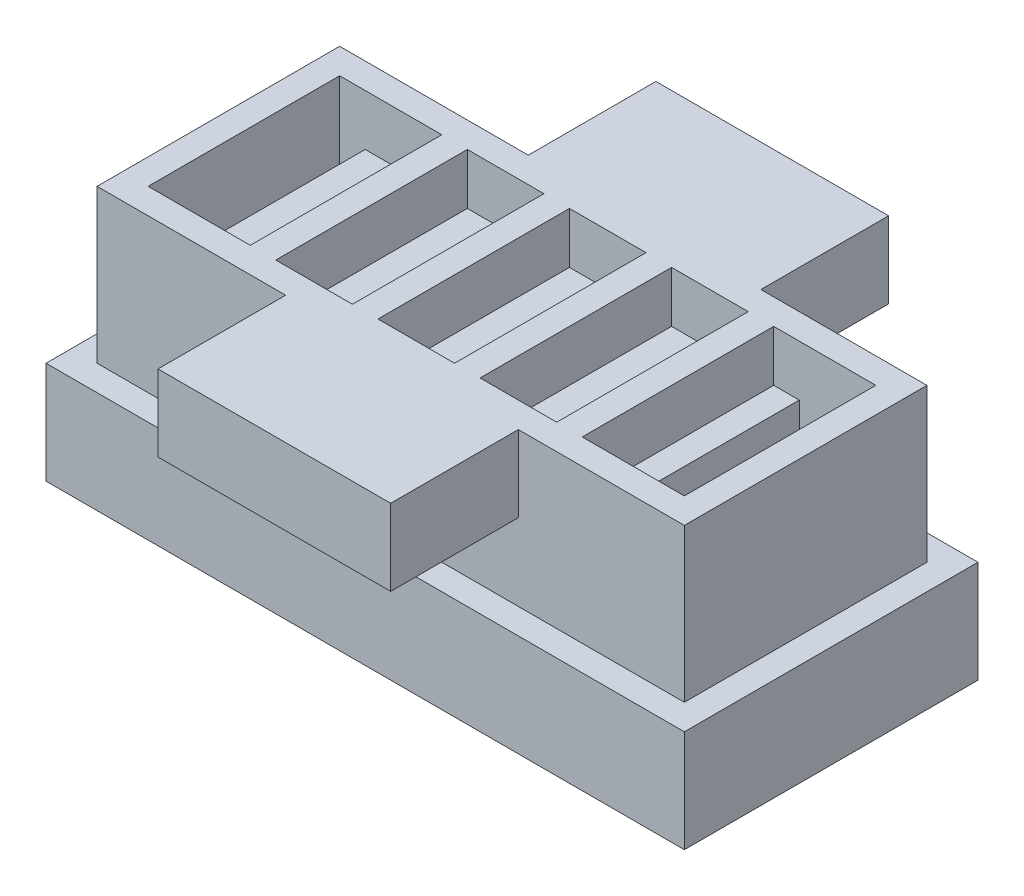
from build123d import *

# Parameters (mm, degrees)
SKETCH1_W           = 6
SKETCH1_H           = 15
BOSS_EXTRUDE1_DEPTH = 15
SKETCH2_W           = 2
SKETCH2_H           = 11
CUT_EXTRUDE1_DEPTH  = 13
SKETCH3_W           = 15
SKETCH3_H           = 4
BOSS_EXTRUDE2_DEPTH = 2
LPATTERN1_COUNT     = 5
LPATTERN1_PITCH     = 8
SKETCH6_W           = 15
SKETCH6_H           = 15
BOSS_EXTRUDE4_DEPTH = 2
SKETCH8_W           = 15
SKETCH8_H           = 11
BOSS_EXTRUDE5_DEPTH = 2
SKETCH9_W           = 34
SKETCH9_H           = 2
CUT_EXTRUDE2_DEPTH  = 2
BOSS_EXTRUDE6_START = -15
SKETCH10_W          = 46
SKETCH10_H          = 19
BOSS_EXTRUDE6_DEPTH = 20
SPLIT1_START        = -17
SPLIT1_OUTLINE_W    = 46
SPLIT1_OUTLINE_H    = 5
SPLIT1_DEPTH        = 19
SPLIT1_START_2      = -13
SPLIT1_2_OUTLINE_W  = 2
SPLIT1_2_OUTLINE_H  = 13
SPLIT1_2_DEPTH      = 11
SPLIT1_START_3      = -8.5
SPLIT1_3_OUTLINE_W  = 6
SPLIT1_3_OUTLINE_H  = 2
SPLIT1_3_DEPTH      = 2
SPLIT1_START_4      = -5
SPLIT1_4_OUTLINE_W  = 46
SPLIT1_4_OUTLINE_H  = 19
SPLIT1_4_DEPTH      = 5
SPLIT1_5_OUTLINE_W  = 2
SPLIT1_5_OUTLINE_H  = 11
SPLIT1_5_DEPTH      = 13
SPLIT1_6_OUTLINE_W  = 6
SPLIT1_6_OUTLINE_H  = 2
SPLIT1_6_DEPTH      = 2
SKETCH11_W          = 18.225114874
SKETCH11_H          = 5.976921675
BOSS_EXTRUDE7_DEPTH = 10
SKETCH12_W          = 50
SKETCH12_H          = 23
SKETCH12_W_2        = 46
SKETCH12_H_2        = 19
BOSS_EXTRUDE8_DEPTH = 8


# Read off the part's stored shape, not the designer's step: Split1
with BuildPart() as part:
    # Sketch1 → Boss-Extrude1 (new body)
    with BuildSketch(Plane(origin=(0, 0, 0), x_dir=(1, 0, 0), z_dir=(0, 1, 0))):
        with Locations((3, 7.5)):
            Rectangle(SKETCH1_W, SKETCH1_H)
    extrude(amount=BOSS_EXTRUDE1_DEPTH)

    # Sketch2 → Cut-Extrude1 (cut)
    with BuildSketch(Plane.XZ):
        with Locations((3, -7.5)):
            Rectangle(SKETCH2_W, SKETCH2_H)
    extrude(amount=-CUT_EXTRUDE1_DEPTH, mode=Mode.SUBTRACT)

    # Sketch3 → Boss-Extrude2 (add)
    with BuildSketch(Plane.ZY):
        with Locations((-7.5, 2)):
            Rectangle(SKETCH3_W, SKETCH3_H)
    extrude(amount=BOSS_EXTRUDE2_DEPTH)


with BuildPart() as lpattern1_1:
    # LPattern1: pattern copy
    add(part.part.moved(Location(Vector(-1, 0, 0) * (1 * LPATTERN1_PITCH))))


with BuildPart() as lpattern1_2:
    # LPattern1: pattern copy
    add(part.part.moved(Location(Vector(-1, 0, 0) * (2 * LPATTERN1_PITCH))))


with BuildPart() as lpattern1_3:
    # LPattern1: pattern copy
    add(part.part.moved(Location(Vector(-1, 0, 0) * (3 * LPATTERN1_PITCH))))


with BuildPart() as lpattern1_4:
    # LPattern1: pattern copy
    add(part.part.moved(Location(Vector(-1, 0, 0) * (4 * LPATTERN1_PITCH))))


with BuildPart() as lpattern1_1_1:
    add(lpattern1_1.part)

    # Combine1: union LPattern1_2, LPattern1_3, part, LPattern1_4
    add(lpattern1_2.part)
    add(lpattern1_3.part)
    add(part.part)
    add(lpattern1_4.part)

    # Sketch6 → Boss-Extrude4 (add)
    with BuildSketch(Plane(origin=(6, 0, 0), x_dir=(0, 0, -1), z_dir=(1, 0, 0))):
        with Locations((7.5, 7.5)):
            Rectangle(SKETCH6_W, SKETCH6_H)
    extrude(amount=BOSS_EXTRUDE4_DEPTH)

    # Sketch8 → Boss-Extrude5 (add)
    with BuildSketch(Plane.ZY.offset(32)):
        with Locations((-7.5, 9.5)):
            Rectangle(SKETCH8_W, SKETCH8_H)
    extrude(amount=BOSS_EXTRUDE5_DEPTH)

    # Sketch9 → Cut-Extrude2 (cut)
    with BuildSketch(Plane.XZ):
        with Locations((-13, -7.5)):
            Rectangle(SKETCH9_W, SKETCH9_H)
    extrude(amount=-CUT_EXTRUDE2_DEPTH, mode=Mode.SUBTRACT)


with BuildPart() as body_2:
    # Sketch10 → Boss-Extrude6 (new body)
    with BuildSketch(Plane.XZ.offset(BOSS_EXTRUDE6_START)):
        with Locations((-13, -7.5)):
            Rectangle(SKETCH10_W, SKETCH10_H)
    extrude(amount=BOSS_EXTRUDE6_DEPTH)

    # Combine2: cut LPattern1_1
    add(lpattern1_1_1.part, mode=Mode.SUBTRACT)

    # Split1 4 outline → Split1 4 (cut)
    with BuildSketch(Plane(origin=(0, 0, 0), x_dir=(1, 0, 0), z_dir=(0, 1, 0)).offset(SPLIT1_START_4)):
        with Locations((-13, 7.5)):
            Rectangle(SPLIT1_4_OUTLINE_W, SPLIT1_4_OUTLINE_H)
    extrude(amount=SPLIT1_4_DEPTH, mode=Mode.SUBTRACT)

    # Split1 5 outline → Split1 5 (cut)
    with BuildSketch(Plane(origin=(0, 0, 0), x_dir=(1, 0, 0), z_dir=(0, 1, 0))):
        with Locations((-5, 7.5)):
            Rectangle(SPLIT1_5_OUTLINE_W, SPLIT1_5_OUTLINE_H)
        with Locations((3, 7.5)):
            Rectangle(SPLIT1_5_OUTLINE_W, SPLIT1_5_OUTLINE_H)
        with Locations((-13, 7.5)):
            Rectangle(SPLIT1_5_OUTLINE_W, SPLIT1_5_OUTLINE_H)
        with Locations((-21, 7.5)):
            Rectangle(SPLIT1_5_OUTLINE_W, SPLIT1_5_OUTLINE_H)
        with Locations((-29, 7.5)):
            Rectangle(SPLIT1_5_OUTLINE_W, SPLIT1_5_OUTLINE_H)
    extrude(amount=SPLIT1_5_DEPTH, mode=Mode.SUBTRACT)

    # Split1 6 outline → Split1 6 (cut)
    with BuildSketch(Plane(origin=(0, 0, 0), x_dir=(1, 0, 0), z_dir=(0, 1, 0))):
        with Locations((-1, 7.5)):
            Rectangle(SPLIT1_6_OUTLINE_W, SPLIT1_6_OUTLINE_H)
        with Locations((-9, 7.5)):
            Rectangle(SPLIT1_6_OUTLINE_W, SPLIT1_6_OUTLINE_H)
        with Locations((-17, 7.5)):
            Rectangle(SPLIT1_6_OUTLINE_W, SPLIT1_6_OUTLINE_H)
        with Locations((-25, 7.5)):
            Rectangle(SPLIT1_6_OUTLINE_W, SPLIT1_6_OUTLINE_H)
    extrude(amount=SPLIT1_6_DEPTH, mode=Mode.SUBTRACT)

    # Sketch11 → Boss-Extrude7 (add)
    with BuildSketch(Plane(origin=(0, 0, -17), x_dir=(-1, 0, 0), z_dir=(0, 0, -1))):
        with Locations((12.114956568, 12.011539163)):
            Rectangle(SKETCH11_W, SKETCH11_H)
    boss_extrude7 = extrude(amount=BOSS_EXTRUDE7_DEPTH)

    # Mirror1: Boss-Extrude7 across plane
    add(boss_extrude7.mirror(Plane.XY.offset(-7.5)))


with BuildPart() as body_2_2:
    # Split1 outline → Split1 (new body)
    with BuildSketch(Plane.XY.offset(SPLIT1_START)):
        with Locations((-13, -2.5)):
            Rectangle(SPLIT1_OUTLINE_W, SPLIT1_OUTLINE_H)
    extrude(amount=SPLIT1_DEPTH)

    # Split1 2 outline → Split1 2 (add)
    with BuildSketch(Plane.XY.offset(SPLIT1_START_2)):
        with Locations((-29, 6.5)):
            Rectangle(SPLIT1_2_OUTLINE_W, SPLIT1_2_OUTLINE_H)
        with Locations((-21, 6.5)):
            Rectangle(SPLIT1_2_OUTLINE_W, SPLIT1_2_OUTLINE_H)
        with Locations((-13, 6.5)):
            Rectangle(SPLIT1_2_OUTLINE_W, SPLIT1_2_OUTLINE_H)
        with Locations((3, 6.5)):
            Rectangle(SPLIT1_2_OUTLINE_W, SPLIT1_2_OUTLINE_H)
        with Locations((-5, 6.5)):
            Rectangle(SPLIT1_2_OUTLINE_W, SPLIT1_2_OUTLINE_H)
    extrude(amount=SPLIT1_2_DEPTH)

    # Split1 3 outline → Split1 3 (add)
    with BuildSketch(Plane.XY.offset(SPLIT1_START_3)):
        with Locations((-25, 1)):
            Rectangle(SPLIT1_3_OUTLINE_W, SPLIT1_3_OUTLINE_H)
        with Locations((-17, 1)):
            Rectangle(SPLIT1_3_OUTLINE_W, SPLIT1_3_OUTLINE_H)
        with Locations((-9, 1)):
            Rectangle(SPLIT1_3_OUTLINE_W, SPLIT1_3_OUTLINE_H)
        with Locations((-1, 1)):
            Rectangle(SPLIT1_3_OUTLINE_W, SPLIT1_3_OUTLINE_H)
    extrude(amount=SPLIT1_3_DEPTH)

    # Sketch12 → Boss-Extrude8 (add)
    with BuildSketch(Plane.XZ.offset(5)):
        with Locations((-13, -7.5)):
            Rectangle(SKETCH12_W, SKETCH12_H)
        with Locations((-13, -7.5)):
            Rectangle(SKETCH12_W_2, SKETCH12_H_2, mode=Mode.SUBTRACT)
    extrude(amount=-BOSS_EXTRUDE8_DEPTH)


solid = Compound([body_2.part, body_2_2.part])
